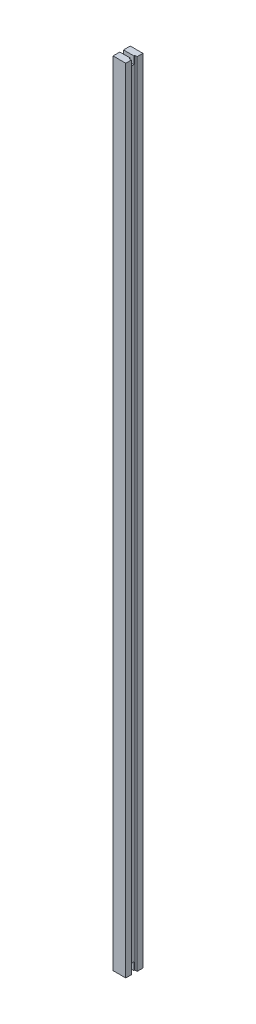
from build123d import *

# Parameters (mm, degrees)
EXTRUDE_1_DEPTH     = 1383.55
SKETCH_2_W          = 6.397518836
SKETCH_2_H          = 13.287823591
CUT_EXTRUDE_1_DEPTH = 1384.808222431


with BuildPart() as part:
    # Эскиз1 → Бобышка-Вытянуть1 (new body)
    with BuildSketch(Plane(origin=(0, 0, 0), x_dir=(1, 0, 0), z_dir=(0, 1, 0))):
        Polygon((-11.764865627, 15), (10.361904762, 15), (10.361904762, 5), (6.306381239, 5), (6.306381239, -5), (10.361904762, -5), (10.361904762, -15), (-11.764865627, -15), align=None)
    extrude(amount=EXTRUDE_1_DEPTH)

    # Эскиз2 → Вырез-Вытянуть1 (cut, through all)
    with BuildSketch(Plane.ZY.offset(11.764865627)):
        with Locations((0, 6.643911796)):
            Rectangle(SKETCH_2_W, SKETCH_2_H)
        with Locations((0, 1376.906088205)):
            Rectangle(SKETCH_2_W, SKETCH_2_H)
    extrude(amount=-CUT_EXTRUDE_1_DEPTH, mode=Mode.SUBTRACT)


solid = part.part
